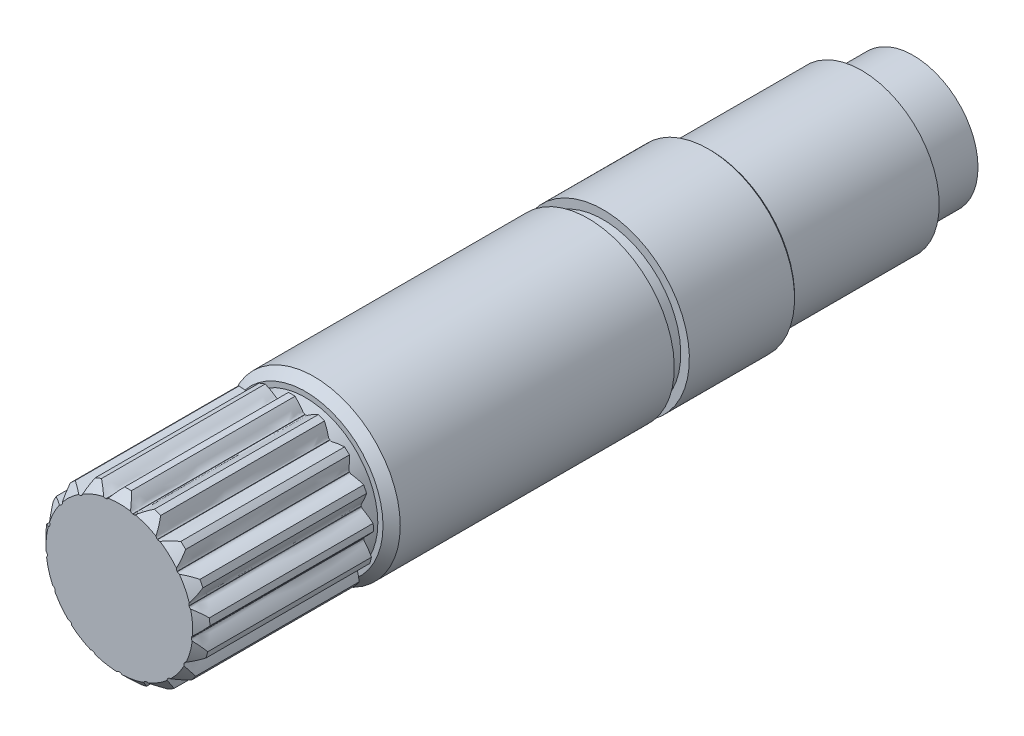
from build123d import *
from OCP.BRepFilletAPI import BRepFilletAPI_MakeChamfer

# Parameters (mm, degrees)
SKETCH12_R              = 10
SHAFT_DEPTH             = 21.5
SKETCH13_R              = 8.398146
MOTOR_SIDE_RELIEF_DEPTH = 1.587
MOTOR_SPLINE_DEPTH      = 20
CHAMFER3_SIZE           = 1
SKETCH23_W              = 1
SKETCH23_H              = 1.75
CHAMFER4_SIZE           = 1
CHAMFER4_SIZE2          = 0.466307658
CHAMFER5_SIZE           = 0.25
CHAMFER6_SIZE           = 1


with BuildPart() as part:
    # Sketch12 → Shaft (new, symmetric)
    with BuildSketch(Plane.XY):
        Circle(SKETCH12_R)
    extrude(amount=SHAFT_DEPTH, both=True)

    # Sketch13 → Motor side relief (add)
    with BuildSketch(Plane.XY.offset(21.5)):
        Circle(SKETCH13_R)
    extrude(amount=MOTOR_SIDE_RELIEF_DEPTH)

    # Sketch15 → Motor spline (add)
    with BuildSketch(Plane.XY.offset(23.087)):
        with BuildLine():
            Line((4.440221189, 7.12834427), (4.421054163, 7.140247638))
            Line((4.421054163, 7.140247638), (4.401855226, 7.152099468))
            add(Edge.make_bspline(
                [(4.401855226, 7.152099468), (4.346074893, 7.18643022), (4.303271658, 7.233316124), (4.247234181, 7.342487901), (4.237804809, 7.408052721), (4.194006084, 7.602023317), (4.124459498, 7.868486133), (3.983153486, 8.288727427), (3.862105942, 8.580360972), (3.794372065, 8.728433243)],
                knots=[0, 0, 0, 0, 0.125, 0.125, 0.25, 0.25, 0.5, 0.75, 1, 1, 1, 1], degree=3, weights=[1, 1, 1, 1, 1, 1, 1, 1, 1, 1]))
            ThreePointArc((3.794372065, 8.728433243), (3.438117558, 8.874804443), (3.076232661, 9.006641931))
            add(Edge.make_bspline(
                [(3.076232661, 9.006641931), (2.926421077, 8.942847219), (2.64049232, 8.808876568), (2.252952462, 8.593511743), (2.022042097, 8.443446649), (1.858997303, 8.329607659), (1.80785818, 8.287507199), (1.692897433, 8.244580486), (1.629678632, 8.238767738), (1.56532799, 8.250975974)],
                knots=[0, 0, 0, 0, 0.25, 0.5, 0.75, 0.75, 0.875, 0.875, 1, 1, 1, 1], degree=3, weights=[1, 1, 1, 1, 1, 1, 1, 1, 1, 1]))
            Line((1.56532799, 8.250975974), (1.543155278, 8.255151605))
            Line((1.543155278, 8.255151605), (1.520971428, 8.259267652))
            add(Edge.make_bspline(
                [(1.520971428, 8.259267652), (1.456556118, 8.271129944), (1.399706148, 8.299387436), (1.308015362, 8.380944015), (1.27553799, 8.438675107), (1.164626634, 8.603725376), (1.003518902, 8.827071428), (0.719946305, 9.167889145), (0.501722644, 9.39610191), (0.38507281, 9.509706892)],
                knots=[0, 0, 0, 0, 0.125, 0.125, 0.25, 0.25, 0.5, 0.75, 1, 1, 1, 1], degree=3, weights=[1, 1, 1, 1, 1, 1, 1, 1, 1, 1]))
            ThreePointArc((0.38507281, 9.509706892), (0, 9.5175), (-0.38507281, 9.509706892))
            add(Edge.make_bspline(
                [(-0.38507281, 9.509706892), (-0.501722644, 9.39610191), (-0.719947489, 9.167888617), (-1.003518896, 8.827071355), (-1.164626634, 8.603725376), (-1.27553799, 8.438675107), (-1.308015362, 8.380944015), (-1.399706148, 8.299387436), (-1.456556118, 8.271129944), (-1.520971428, 8.259267652)],
                knots=[0, 0, 0, 0, 0.25, 0.5, 0.75, 0.75, 0.875, 0.875, 1, 1, 1, 1], degree=3, weights=[1, 1, 1, 1, 1, 1, 1, 1, 1, 1]))
            Line((-1.520971428, 8.259267652), (-1.543155278, 8.255151605))
            Line((-1.543155278, 8.255151605), (-1.56532799, 8.250975974))
            add(Edge.make_bspline(
                [(-1.56532799, 8.250975974), (-1.629678632, 8.238767738), (-1.692897433, 8.244580486), (-1.80785818, 8.287507199), (-1.858997303, 8.329607659), (-2.022042097, 8.443446649), (-2.252952482, 8.593511814), (-2.640493614, 8.808876633), (-2.926421077, 8.942847219), (-3.076232661, 9.006641931)],
                knots=[0, 0, 0, 0, 0.125, 0.125, 0.25, 0.25, 0.5, 0.75, 1, 1, 1, 1], degree=3, weights=[1, 1, 1, 1, 1, 1, 1, 1, 1, 1]))
            ThreePointArc((-3.076232661, 9.006641931), (-3.438117558, 8.874804443), (-3.794372065, 8.728433243))
            add(Edge.make_bspline(
                [(-3.794372065, 8.728433243), (-3.862105942, 8.580360972), (-3.9831544, 8.288726508), (-4.124459466, 7.868486068), (-4.194006084, 7.602023317), (-4.237804809, 7.408052721), (-4.247234181, 7.342487901), (-4.303271658, 7.233316124), (-4.346074893, 7.18643022), (-4.401855226, 7.152099468)],
                knots=[0, 0, 0, 0, 0.25, 0.5, 0.75, 0.75, 0.875, 0.875, 1, 1, 1, 1], degree=3, weights=[1, 1, 1, 1, 1, 1, 1, 1, 1, 1]))
            Line((-4.401855226, 7.152099468), (-4.421054163, 7.140247638))
            Line((-4.421054163, 7.140247638), (-4.440221189, 7.12834427))
            add(Edge.make_bspline(
                [(-4.440221189, 7.12834427), (-4.495816252, 7.093714296), (-4.556865835, 7.076297257), (-4.679570456, 7.074796613), (-4.742464709, 7.095580541), (-4.935622837, 7.142833664), (-5.20515015, 7.199350811), (-5.644320239, 7.260176519), (-5.959335416, 7.281811458), (-6.122075865, 7.287180068)],
                knots=[0, 0, 0, 0, 0.125, 0.125, 0.25, 0.25, 0.5, 0.75, 1, 1, 1, 1], degree=3, weights=[1, 1, 1, 1, 1, 1, 1, 1, 1, 1]))
            ThreePointArc((-6.122075865, 7.287180068), (-6.411898288, 7.03351737), (-6.691220346, 6.768336319))
            add(Edge.make_bspline(
                [(-6.691220346, 6.768336319), (-6.700890432, 6.605794739), (-6.708414237, 6.290125953), (-6.688368931, 5.847218136), (-6.656961773, 5.573625885), (-6.627732607, 5.376931766), (-6.612840489, 5.312388111), (-6.625656486, 5.190345388), (-6.648632171, 5.131163273), (-6.688244085, 5.07900062)],
                knots=[0, 0, 0, 0, 0.25, 0.5, 0.75, 0.75, 0.875, 0.875, 1, 1, 1, 1], degree=3, weights=[1, 1, 1, 1, 1, 1, 1, 1, 1, 1]))
            Line((-6.688244085, 5.07900062), (-6.701865185, 5.061013661))
            Line((-6.701865185, 5.061013661), (-6.715437913, 5.042990172))
            add(Edge.make_bspline(
                [(-6.715437913, 5.042990172), (-6.754768975, 4.990615431), (-6.805404256, 4.952320872), (-6.919280812, 4.906595542), (-6.985435977, 4.903255953), (-7.182620365, 4.877541414), (-7.454363447, 4.832877588), (-7.88585014, 4.730949337), (-8.187408485, 4.637326709), (-8.3410988, 4.583544158)],
                knots=[0, 0, 0, 0, 0.125, 0.125, 0.25, 0.25, 0.5, 0.75, 1, 1, 1, 1], degree=3, weights=[1, 1, 1, 1, 1, 1, 1, 1, 1, 1]))
            ThreePointArc((-8.3410988, 4.583544158), (-8.519716625, 4.242314801), (-8.684382243, 3.89413807))
            add(Edge.make_bspline(
                [(-8.684382243, 3.89413807), (-8.634682538, 3.739079323), (-8.527665559, 3.442009035), (-8.34897711, 3.036250994), (-8.220857887, 2.792479392), (-8.12254839, 2.619626382), (-8.085346046, 2.564820869), (-8.05320969, 2.446389747), (-8.053254834, 2.382904293), (-8.071348519, 2.319954594)],
                knots=[0, 0, 0, 0, 0.25, 0.5, 0.75, 0.75, 0.875, 0.875, 1, 1, 1, 1], degree=3, weights=[1, 1, 1, 1, 1, 1, 1, 1, 1, 1]))
            Line((-8.071348519, 2.319954594), (-8.077552178, 2.298261745))
            Line((-8.077552178, 2.298261745), (-8.083697534, 2.276552308))
            add(Edge.make_bspline(
                [(-8.083697534, 2.276552308), (-8.101452719, 2.213506297), (-8.134835122, 2.159506112), (-8.224503954, 2.075731554), (-8.284985409, 2.048719478), (-8.459565212, 1.953510168), (-8.696823654, 1.813697467), (-9.062352282, 1.562781232), (-9.30972667, 1.366545292), (-9.433610123, 1.260875211)],
                knots=[0, 0, 0, 0, 0.125, 0.125, 0.25, 0.25, 0.5, 0.75, 1, 1, 1, 1], degree=3, weights=[1, 1, 1, 1, 1, 1, 1, 1, 1, 1]))
            ThreePointArc((-9.433610123, 1.260875211), (-9.476900023, 0.878164111), (-9.504670196, 0.494014896))
            add(Edge.make_bspline(
                [(-9.504670196, 0.494014896), (-9.402312921, 0.367380525), (-9.195208395, 0.129029723), (-8.882009667, -0.184778668), (-8.67448159, -0.365806916), (-8.520369004, -0.491474062), (-8.465880817, -0.529139644), (-8.393132302, -0.627964385), (-8.370240806, -0.687179116), (-8.364372611, -0.752414155)],
                knots=[0, 0, 0, 0, 0.25, 0.5, 0.75, 0.75, 0.875, 0.875, 1, 1, 1, 1], degree=3, weights=[1, 1, 1, 1, 1, 1, 1, 1, 1, 1]))
            Line((-8.364372611, -0.752414155), (-8.36232099, -0.774883154))
            Line((-8.36232099, -0.774883154), (-8.360209011, -0.79734656))
            add(Edge.make_bspline(
                [(-8.360209011, -0.79734656), (-8.353990381, -0.862549127), (-8.365611428, -0.924961915), (-8.418962263, -1.035471482), (-8.465601653, -1.082507914), (-8.593998901, -1.234353451), (-8.764729637, -1.450432547), (-9.014933532, -1.816449138), (-9.174714682, -2.088795639), (-9.252060125, -2.23208192)],
                knots=[0, 0, 0, 0, 0.125, 0.125, 0.25, 0.25, 0.5, 0.75, 1, 1, 1, 1], degree=3, weights=[1, 1, 1, 1, 1, 1, 1, 1, 1, 1]))
            ThreePointArc((-9.252060125, -2.23208192), (-9.154175559, -2.604587508), (-9.041299772, -2.972827726))
            add(Edge.make_bspline(
                [(-9.041299772, -2.972827726), (-8.900108844, -3.053935048), (-8.620887383, -3.201375768), (-8.215477602, -3.380852948), (-7.956568487, -3.474688973), (-7.767466572, -3.53619821), (-7.703051473, -3.551636916), (-7.599515889, -3.617508448), (-7.556779376, -3.664455177), (-7.527741833, -3.723165203)],
                knots=[0, 0, 0, 0, 0.25, 0.5, 0.75, 0.75, 0.875, 0.875, 1, 1, 1, 1], degree=3, weights=[1, 1, 1, 1, 1, 1, 1, 1, 1, 1]))
            Line((-7.527741833, -3.723165203), (-7.517712015, -3.74337579))
            Line((-7.517712015, -3.74337579), (-7.507627934, -3.763559357))
            add(Edge.make_bspline(
                [(-7.507627934, -3.763559357), (-7.478275351, -3.822112512), (-7.466565555, -3.88450871), (-7.476393067, -4.006828357), (-7.502891484, -4.067536614), (-7.567765417, -4.255510796), (-7.648910315, -4.518673608), (-7.749998055, -4.950357987), (-7.800606636, -5.262033145), (-7.82096814, -5.423584019)],
                knots=[0, 0, 0, 0, 0.125, 0.125, 0.25, 0.25, 0.5, 0.75, 1, 1, 1, 1], degree=3, weights=[1, 1, 1, 1, 1, 1, 1, 1, 1, 1]))
            ThreePointArc((-7.82096814, -5.423584019), (-7.595128961, -5.735575152), (-7.356851714, -6.038173492))
            add(Edge.make_bspline(
                [(-7.356851714, -6.038173492), (-7.19589575, -6.062799771), (-6.882267761, -6.099417722), (-6.439399763, -6.120324303), (-6.164076721, -6.114295031), (-5.965524738, -6.103339195), (-5.899882343, -6.094465941), (-5.779542744, -6.118487949), (-5.722733018, -6.146826261), (-5.674447808, -6.19108216)],
                knots=[0, 0, 0, 0, 0.25, 0.5, 0.75, 0.75, 0.875, 0.875, 1, 1, 1, 1], degree=3, weights=[1, 1, 1, 1, 1, 1, 1, 1, 1, 1]))
            Line((-5.674447808, -6.19108216), (-5.657794375, -6.206304782))
            Line((-5.657794375, -6.206304782), (-5.641100105, -6.221482608))
            add(Edge.make_bspline(
                [(-5.641100105, -6.221482608), (-5.592577797, -6.265478423), (-5.559118631, -6.319431079), (-5.524095559, -6.437040859), (-5.526874245, -6.503221956), (-5.51946328, -6.701937828), (-5.50006327, -6.97664276), (-5.438382397, -7.415693559), (-5.37298344, -7.724603916), (-5.333611069, -7.882601043)],
                knots=[0, 0, 0, 0, 0.125, 0.125, 0.25, 0.25, 0.5, 0.75, 1, 1, 1, 1], degree=3, weights=[1, 1, 1, 1, 1, 1, 1, 1, 1, 1]))
            ThreePointArc((-5.333611069, -7.882601043), (-5.01031811, -8.091941589), (-4.678820066, -8.288030468))
            add(Edge.make_bspline(
                [(-4.678820066, -8.288030468), (-4.519837062, -8.252849789), (-4.214159742, -8.173699515), (-3.793645304, -8.033211947), (-3.539092238, -7.928131664), (-3.357905732, -7.846190402), (-3.29990141, -7.814203571), (-3.179010326, -7.793131749), (-3.115799855, -7.799034398), (-3.054788163, -7.822859165)],
                knots=[0, 0, 0, 0, 0.25, 0.5, 0.75, 0.75, 0.875, 0.875, 1, 1, 1, 1], degree=3, weights=[1, 1, 1, 1, 1, 1, 1, 1, 1, 1]))
            Line((-3.054788163, -7.822859165), (-3.033760254, -7.831037923))
            Line((-3.033760254, -7.831037923), (-3.012710447, -7.839160159))
            add(Edge.make_bspline(
                [(-3.012710447, -7.839160159), (-2.951571621, -7.862656755), (-2.900881931, -7.900879263), (-2.825738336, -7.997895325), (-2.804422014, -8.060611137), (-2.725727042, -8.24323102), (-2.608402205, -8.492377648), (-2.392283061, -8.879498624), (-2.219709058, -9.143924126), (-2.12592027, -9.277029118)],
                knots=[0, 0, 0, 0, 0.125, 0.125, 0.25, 0.25, 0.5, 0.75, 1, 1, 1, 1], degree=3, weights=[1, 1, 1, 1, 1, 1, 1, 1, 1, 1]))
            ThreePointArc((-2.12592027, -9.277029118), (-1.748836036, -9.355446476), (-1.368887842, -9.418543004))
            add(Edge.make_bspline(
                [(-1.368887842, -9.418543004), (-1.233349333, -9.328306713), (-0.976906098, -9.144077896), (-0.635538026, -8.861169804), (-0.436133737, -8.671230184), (-0.29678295, -8.529370118), (-0.254250507, -8.478589709), (-0.149134948, -8.415269923), (-0.088060657, -8.397939724), (-0.02256245, -8.398115692)],
                knots=[0, 0, 0, 0, 0.25, 0.5, 0.75, 0.75, 0.875, 0.875, 1, 1, 1, 1], degree=3, weights=[1, 1, 1, 1, 1, 1, 1, 1, 1, 1]))
            Line((-0.02256245, -8.398115692), (0, -8.398146))
            Line((0, -8.398146), (0.02256245, -8.398115692))
            add(Edge.make_bspline(
                [(0.02256245, -8.398115692), (0.088060657, -8.397939724), (0.149134948, -8.415269923), (0.254250507, -8.478589709), (0.29678295, -8.529370118), (0.436133737, -8.671230184), (0.635538032, -8.861169877), (0.976907359, -9.144078197), (1.233349333, -9.328306713), (1.368887842, -9.418543004)],
                knots=[0, 0, 0, 0, 0.125, 0.125, 0.25, 0.25, 0.5, 0.75, 1, 1, 1, 1], degree=3, weights=[1, 1, 1, 1, 1, 1, 1, 1, 1, 1]))
            ThreePointArc((1.368887842, -9.418543004), (1.748836036, -9.355446476), (2.12592027, -9.277029118))
            add(Edge.make_bspline(
                [(2.12592027, -9.277029118), (2.219709058, -9.143924126), (2.392284128, -8.879497888), (2.608402185, -8.492377578), (2.725727042, -8.24323102), (2.804422014, -8.060611137), (2.825738336, -7.997895325), (2.900881931, -7.900879263), (2.951571621, -7.862656755), (3.012710447, -7.839160159)],
                knots=[0, 0, 0, 0, 0.25, 0.5, 0.75, 0.75, 0.875, 0.875, 1, 1, 1, 1], degree=3, weights=[1, 1, 1, 1, 1, 1, 1, 1, 1, 1]))
            Line((3.012710447, -7.839160159), (3.033760254, -7.831037923))
            Line((3.033760254, -7.831037923), (3.054788163, -7.822859165))
            add(Edge.make_bspline(
                [(3.054788163, -7.822859165), (3.115799855, -7.799034398), (3.179010326, -7.793131749), (3.29990141, -7.814203571), (3.357905732, -7.846190402), (3.539092238, -7.928131664), (3.793645337, -8.033212013), (4.214161026, -8.17369934), (4.519837062, -8.252849789), (4.678820066, -8.288030468)],
                knots=[0, 0, 0, 0, 0.125, 0.125, 0.25, 0.25, 0.5, 0.75, 1, 1, 1, 1], degree=3, weights=[1, 1, 1, 1, 1, 1, 1, 1, 1, 1]))
            ThreePointArc((4.678820066, -8.288030468), (5.01031811, -8.091941589), (5.333611069, -7.882601043))
            add(Edge.make_bspline(
                [(5.333611069, -7.882601043), (5.37298344, -7.724603916), (5.438383126, -7.415692487), (5.500063226, -6.976642702), (5.51946328, -6.701937828), (5.526874245, -6.503221956), (5.524095559, -6.437040859), (5.559118631, -6.319431079), (5.592577797, -6.265478423), (5.641100105, -6.221482608)],
                knots=[0, 0, 0, 0, 0.25, 0.5, 0.75, 0.75, 0.875, 0.875, 1, 1, 1, 1], degree=3, weights=[1, 1, 1, 1, 1, 1, 1, 1, 1, 1]))
            Line((5.641100105, -6.221482608), (5.657794375, -6.206304782))
            Line((5.657794375, -6.206304782), (5.674447808, -6.19108216))
            add(Edge.make_bspline(
                [(5.674447808, -6.19108216), (5.722733018, -6.146826261), (5.779542744, -6.118487949), (5.899882343, -6.094465941), (5.965524738, -6.103339195), (6.164076721, -6.114295031), (6.439399817, -6.120324352), (6.882268896, -6.099417095), (7.19589575, -6.062799771), (7.356851714, -6.038173492)],
                knots=[0, 0, 0, 0, 0.125, 0.125, 0.25, 0.25, 0.5, 0.75, 1, 1, 1, 1], degree=3, weights=[1, 1, 1, 1, 1, 1, 1, 1, 1, 1]))
            ThreePointArc((7.356851714, -6.038173492), (7.595128961, -5.735575152), (7.82096814, -5.423584019))
            add(Edge.make_bspline(
                [(7.82096814, -5.423584019), (7.800606636, -5.262033145), (7.749998348, -4.950356724), (7.648910253, -4.51867357), (7.567765417, -4.255510796), (7.502891484, -4.067536614), (7.476393067, -4.006828357), (7.466565555, -3.88450871), (7.478275351, -3.822112512), (7.507627934, -3.763559357)],
                knots=[0, 0, 0, 0, 0.25, 0.5, 0.75, 0.75, 0.875, 0.875, 1, 1, 1, 1], degree=3, weights=[1, 1, 1, 1, 1, 1, 1, 1, 1, 1]))
            Line((7.507627934, -3.763559357), (7.517712015, -3.74337579))
            Line((7.517712015, -3.74337579), (7.527741833, -3.723165203))
            add(Edge.make_bspline(
                [(7.527741833, -3.723165203), (7.556779376, -3.664455177), (7.599515889, -3.617508448), (7.703051473, -3.551636916), (7.767466572, -3.53619821), (7.956568487, -3.474688973), (8.21547767, -3.380852974), (8.620888215, -3.201374774), (8.900108844, -3.053935048), (9.041299772, -2.972827726)],
                knots=[0, 0, 0, 0, 0.125, 0.125, 0.25, 0.25, 0.5, 0.75, 1, 1, 1, 1], degree=3, weights=[1, 1, 1, 1, 1, 1, 1, 1, 1, 1]))
            ThreePointArc((9.041299772, -2.972827726), (9.154175559, -2.604587508), (9.252060125, -2.23208192))
            add(Edge.make_bspline(
                [(9.252060125, -2.23208192), (9.174714682, -2.088795639), (9.014933348, -1.816447855), (8.764729565, -1.450432533), (8.593998901, -1.234353451), (8.465601653, -1.082507914), (8.418962263, -1.035471482), (8.365611428, -0.924961915), (8.353990381, -0.862549127), (8.360209011, -0.79734656)],
                knots=[0, 0, 0, 0, 0.25, 0.5, 0.75, 0.75, 0.875, 0.875, 1, 1, 1, 1], degree=3, weights=[1, 1, 1, 1, 1, 1, 1, 1, 1, 1]))
            Line((8.360209011, -0.79734656), (8.36232099, -0.774883154))
            Line((8.36232099, -0.774883154), (8.364372611, -0.752414155))
            add(Edge.make_bspline(
                [(8.364372611, -0.752414155), (8.370240806, -0.687179116), (8.393132302, -0.627964385), (8.465880817, -0.529139644), (8.520369004, -0.491474062), (8.67448159, -0.365806916), (8.88200974, -0.184778668), (9.195208811, 0.12903095), (9.402312921, 0.367380525), (9.504670196, 0.494014896)],
                knots=[0, 0, 0, 0, 0.125, 0.125, 0.25, 0.25, 0.5, 0.75, 1, 1, 1, 1], degree=3, weights=[1, 1, 1, 1, 1, 1, 1, 1, 1, 1]))
            ThreePointArc((9.504670196, 0.494014896), (9.476900023, 0.878164111), (9.433610123, 1.260875211))
            add(Edge.make_bspline(
                [(9.433610123, 1.260875211), (9.30972667, 1.366545292), (9.062351647, 1.562782362), (8.696823583, 1.813697454), (8.459565212, 1.953510168), (8.284985409, 2.048719478), (8.224503954, 2.075731554), (8.134835122, 2.159506112), (8.101452719, 2.213506297), (8.083697534, 2.276552308)],
                knots=[0, 0, 0, 0, 0.25, 0.5, 0.75, 0.75, 0.875, 0.875, 1, 1, 1, 1], degree=3, weights=[1, 1, 1, 1, 1, 1, 1, 1, 1, 1]))
            Line((8.083697534, 2.276552308), (8.077552178, 2.298261745))
            Line((8.077552178, 2.298261745), (8.071348519, 2.319954594))
            add(Edge.make_bspline(
                [(8.071348519, 2.319954594), (8.053254834, 2.382904293), (8.05320969, 2.446389747), (8.085346046, 2.564820869), (8.12254839, 2.619626382), (8.220857887, 2.792479392), (8.348977178, 3.036251021), (8.527665504, 3.442010329), (8.634682538, 3.739079323), (8.684382243, 3.89413807)],
                knots=[0, 0, 0, 0, 0.125, 0.125, 0.25, 0.25, 0.5, 0.75, 1, 1, 1, 1], degree=3, weights=[1, 1, 1, 1, 1, 1, 1, 1, 1, 1]))
            ThreePointArc((8.684382243, 3.89413807), (8.519716625, 4.242314801), (8.3410988, 4.583544158))
            add(Edge.make_bspline(
                [(8.3410988, 4.583544158), (8.187408485, 4.637326709), (7.88584914, 4.730950162), (7.454363385, 4.83287755), (7.182620365, 4.877541414), (6.985435977, 4.903255953), (6.919280812, 4.906595542), (6.805404256, 4.952320872), (6.754768975, 4.990615431), (6.715437913, 5.042990172)],
                knots=[0, 0, 0, 0, 0.25, 0.5, 0.75, 0.75, 0.875, 0.875, 1, 1, 1, 1], degree=3, weights=[1, 1, 1, 1, 1, 1, 1, 1, 1, 1]))
            Line((6.715437913, 5.042990172), (6.701865185, 5.061013661))
            Line((6.701865185, 5.061013661), (6.688244085, 5.07900062))
            add(Edge.make_bspline(
                [(6.688244085, 5.07900062), (6.648632171, 5.131163273), (6.625656486, 5.190345388), (6.612840489, 5.312388111), (6.627732607, 5.376931766), (6.656961773, 5.573625885), (6.688368985, 5.847218185), (6.708413718, 6.290127141), (6.700890432, 6.605794739), (6.691220346, 6.768336319)],
                knots=[0, 0, 0, 0, 0.125, 0.125, 0.25, 0.25, 0.5, 0.75, 1, 1, 1, 1], degree=3, weights=[1, 1, 1, 1, 1, 1, 1, 1, 1, 1]))
            ThreePointArc((6.691220346, 6.768336319), (6.411898288, 7.03351737), (6.122075865, 7.287180068))
            add(Edge.make_bspline(
                [(6.122075865, 7.287180068), (5.959335416, 7.281811458), (5.644319009, 7.260176927), (5.205150106, 7.199350753), (4.935622837, 7.142833664), (4.742464709, 7.095580541), (4.679570456, 7.074796613), (4.556865835, 7.076297257), (4.495816252, 7.093714296), (4.440221189, 7.12834427)],
                knots=[0, 0, 0, 0, 0.25, 0.5, 0.75, 0.75, 0.875, 0.875, 1, 1, 1, 1], degree=3, weights=[1, 1, 1, 1, 1, 1, 1, 1, 1, 1]))
        make_face()
    extrude(amount=MOTOR_SPLINE_DEPTH)

    # Chamfer3
    chamfer3_edges = [part.edges().sort_by_distance(p)[0] for p in [
        (-10, 0, 21.5),
    ]]
    chamfer(chamfer3_edges, length=CHAMFER3_SIZE)

    # Sketch23 → snap ring (revolve, cut)
    with BuildSketch(Plane(origin=(0, 0, -31.5), x_dir=(-0.05929694613405617, -0.9982403879723436, 1.1586948537442729e-15), z_dir=(-0.9982403879723436, 0.05929694613405617, 0))):
        with Locations((9.5, 19.32924121)):
            Rectangle(SKETCH23_W, SKETCH23_H)
    revolve(axis=Axis((0, 0, 153.83579317), (0, 0, -1)), mode=Mode.SUBTRACT)

    # Sketch24 → Revolve1 (revolve)
    with BuildSketch(Plane(origin=(0, 0, 0), x_dir=(1, 0, 0), z_dir=(0, 1, 0))):
        Polygon((10, 21.5), (10, 25.5), (9, 25.5), (9, 43.5), (7.5, 43.5), (7.5, 49.5), (0, 49.5), (0, 21.5), align=None)
    revolve(axis=Axis((0, 0, 0), (0, 0, -1)))

    # Chamfer4: one chamfer whose edges measure the first distance from different faces: ONE call of the kernel's chamfer builder (chamfer() names one face for all edges)
    chamfer4_edges_1 = [part.edges().sort_by_distance(p)[0] for p in [
        (-9, 0, -43.5),
    ]]
    chamfer4_side_1 = [part.faces().sort_by_distance(p)[0] for p in [
        (-8.745441559, 0, -43.5),
    ]]
    chamfer4_edges_2 = [part.edges().sort_by_distance(p)[0] for p in [
        (-7.5, 0, -49.5),
    ]]
    chamfer4_side_2 = [part.faces().sort_by_distance(p)[0] for p in [
        (0, 0, -49.5),
    ]]
    chamfer4 = BRepFilletAPI_MakeChamfer(part.part.solid().wrapped)
    for e in chamfer4_edges_1:
        chamfer4.Add(CHAMFER4_SIZE, CHAMFER4_SIZE2, e.wrapped, chamfer4_side_1[0].wrapped)  # the first distance lies on this face
    for e in chamfer4_edges_2:
        chamfer4.Add(CHAMFER4_SIZE, CHAMFER4_SIZE2, e.wrapped, chamfer4_side_2[0].wrapped)  # the first distance lies on this face
    add(Compound.cast(chamfer4.Shape()), mode=Mode.REPLACE)

    # Chamfer5
    chamfer5_edges = [part.edges().sort_by_distance(p)[0] for p in [
        (-10, 0, -25.5),
    ]]
    chamfer(chamfer5_edges, length=CHAMFER5_SIZE)

    # Chamfer6
    chamfer6_edges = [part.edges().sort_by_distance(p)[0] for p in [
        (-7.595128961, -5.735575152, 43.087),
        (-5.01031811, -8.091941589, 43.087),
        (-1.748836036, -9.355446476, 43.087),
        (1.748836036, -9.355446476, 43.087),
        (5.01031811, -8.091941589, 43.087),
        (7.595128961, -5.735575152, 43.087),
        (9.154175559, -2.604587508, 43.087),
        (9.476900023, 0.878164111, 43.087),
        (8.519716625, 4.242314801, 43.087),
        (6.411898288, 7.03351737, 43.087),
        (3.438117558, 8.874804443, 43.087),
        (0, 9.5175, 43.087),
        (-3.438117558, 8.874804443, 43.087),
        (-9.154175559, -2.604587508, 43.087),
        (-9.476900023, 0.878164111, 43.087),
        (-8.519716625, 4.242314801, 43.087),
        (-6.411898288, 7.03351737, 43.087),
    ]]
    chamfer(chamfer6_edges, length=CHAMFER6_SIZE)


solid = part.part
